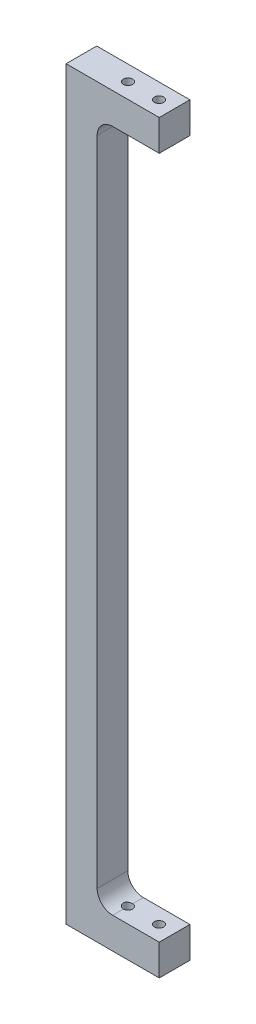
from build123d import *

# Parameters (mm, degrees)
SKETCH1_W           = 10
SKETCH1_H           = 9.875
BOSS_EXTRUDE1_DEPTH = 240
SKETCH2_W           = 9.875
SKETCH2_H           = 10
BOSS_EXTRUDE2_DEPTH = 20
SKETCH3_R           = 1.5
CUT_EXTRUDE1_DEPTH  = 242.349081014
FILLET1_R           = 5


with BuildPart() as part:
    # Sketch1 → Boss-Extrude1 (new body)
    with BuildSketch(Plane(origin=(0, 0, 0), x_dir=(1, 0, 0), z_dir=(0, 1, 0))):
        Rectangle(SKETCH1_W, SKETCH1_H)
    extrude(amount=BOSS_EXTRUDE1_DEPTH)

    # Sketch2 → Boss-Extrude2 (add)
    with BuildSketch(Plane(origin=(5, 0, 0), x_dir=(0, 0, -1), z_dir=(1, 0, 0))):
        with Locations((0, 5)):
            Rectangle(SKETCH2_W, SKETCH2_H)
        with Locations((0, 235)):
            Rectangle(SKETCH2_W, SKETCH2_H)
    extrude(amount=BOSS_EXTRUDE2_DEPTH)

    # Sketch3 → Cut-Extrude1 (cut, through all)
    with BuildSketch(Plane(origin=(0, 240, 0), x_dir=(1, 0, 0), z_dir=(0, 1, 0))):
        with Locations(Location((10, 0, 0), (0, 0, 270))):
            Circle(SKETCH3_R)
        with Locations(Location((20, 0, 0), (0, 0, 270))):
            Circle(SKETCH3_R)
    extrude(amount=-CUT_EXTRUDE1_DEPTH, mode=Mode.SUBTRACT)

    # Fillet1
    # the kernel refuses this fillet: 5 mm, written as the material it adds along each edge
    with BuildSketch(Plane(origin=(5, 10, 4.9375), x_dir=(0, 1, 0), z_dir=(0, 0, -1))) as fillet1_piece_1_section:
        with BuildLine():
            CenterArc((FILLET1_R, FILLET1_R), FILLET1_R, 180, 90)
            Line((0, FILLET1_R), (0, 0))
            Line((0, 0), (FILLET1_R, 0))
        make_face()
    fillet1_piece_1 = extrude(amount=9.875, mode=Mode.PRIVATE)
    fillet1_piece_1 = fillet1_piece_1 - Plane(origin=(10, 11.142134011, 0), x_dir=(0, 0, 1), z_dir=(0, 1, 0)) * Cylinder(1.5, 40, mode=Mode.PRIVATE)
    add(fillet1_piece_1)
    with BuildSketch(Plane(origin=(5, 230, 4.9375), x_dir=(1, 0, 0), z_dir=(0, 0, -1))) as fillet1_piece_2_section:
        with BuildLine():
            CenterArc((FILLET1_R, FILLET1_R), FILLET1_R, 180, 90)
            Line((0, FILLET1_R), (0, 0))
            Line((0, 0), (FILLET1_R, 0))
        make_face()
    fillet1_piece_2 = extrude(amount=9.875, mode=Mode.PRIVATE)
    fillet1_piece_2 = fillet1_piece_2 - Plane(origin=(10, 228.857865929, 0), x_dir=(0, 0, 1), z_dir=(0, 1, 0)) * Cylinder(1.5, 40, mode=Mode.PRIVATE)
    add(fillet1_piece_2)


solid = part.part
